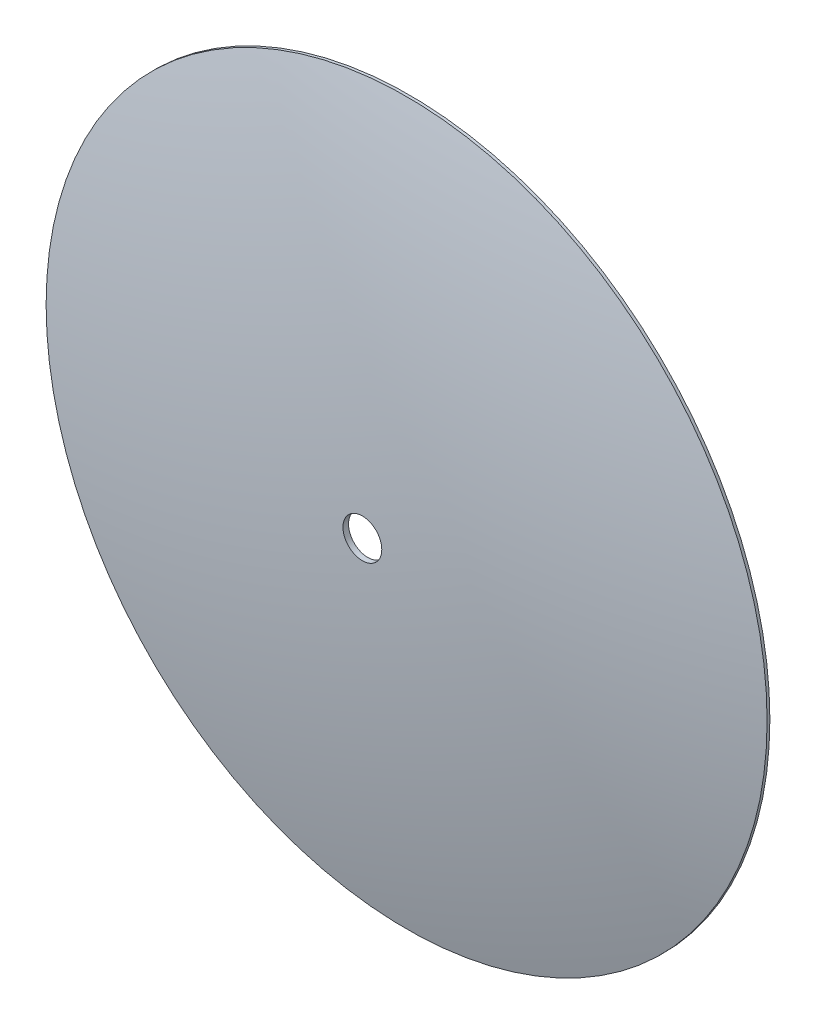
from build123d import *

# Parameters (mm, degrees)
SKETCH17_R              = 165.1
BOSS_EXTRUDE1_DEPTH     = 1.27
DOME2_FACE_RADIUS       = 165.1
DOME2_HEIGHT            = 20.32
CUT_EXTRUDE1_REACH      = 236.483
CUT_EXTRUDE1_END_RADIUS = 680.87875
SKETCH18_R              = 8.89


# Read off the part's stored shape, not the designer's step: Shell2
with BuildPart() as part:
    # Sketch17 → Boss-Extrude1 (new body)
    with BuildSketch(Plane.XY):
        Circle(SKETCH17_R)
    extrude(amount=BOSS_EXTRUDE1_DEPTH)

    # Dome2: a dome of height H over a round flat face of radius A is a cap of a sphere of radius (A * A + H * H) / (2 * H)
    dome2_r = (DOME2_FACE_RADIUS * DOME2_FACE_RADIUS + DOME2_HEIGHT * DOME2_HEIGHT) / (2 * DOME2_HEIGHT)
    dome2_base = Plane((0, 0, 1.27), z_dir=(0, 0, 1))
    with Locations(dome2_base.offset(DOME2_HEIGHT - dome2_r)):
        dome2_ball = Sphere(dome2_r, mode=Mode.PRIVATE)
    add(split(dome2_ball, bisect_by=dome2_base, keep=Keep.TOP, mode=Mode.PRIVATE))

    # Shell2 outline → Shell2 (revolve, cut)
    with BuildSketch(Plane.XZ):
        with BuildLine():
            Line((0, 0), (159.630210195, -1e-07))
            ThreePointArc((159.630210195, -1e-07), (80.381444548, 14.27066321), (0, 19.05))
            Line((0, 19.05), (0, 0))
        make_face()
    revolve(axis=Axis((0, 0, 0), (0, 0, 1)), mode=Mode.SUBTRACT)

    # Cut-Extrude1: up to this sphere (the profile starts inside it)
    cut_extrude1_end = Location((0, 0, -659.28875)) * Sphere(CUT_EXTRUDE1_END_RADIUS, mode=Mode.PRIVATE)
    # Sketch18 → Cut-Extrude1 (cut, up to the surface)
    with BuildSketch(Plane.XY, mode=Mode.PRIVATE) as cut_extrude1_sk1:
        Circle(SKETCH18_R)
    cut_extrude1_tool1 = extrude(cut_extrude1_sk1.sketch, amount=CUT_EXTRUDE1_REACH, mode=Mode.PRIVATE) & cut_extrude1_end
    add(cut_extrude1_tool1.solids().sort_by_distance((0, 0, 0))[0], mode=Mode.SUBTRACT)


solid = part.part
